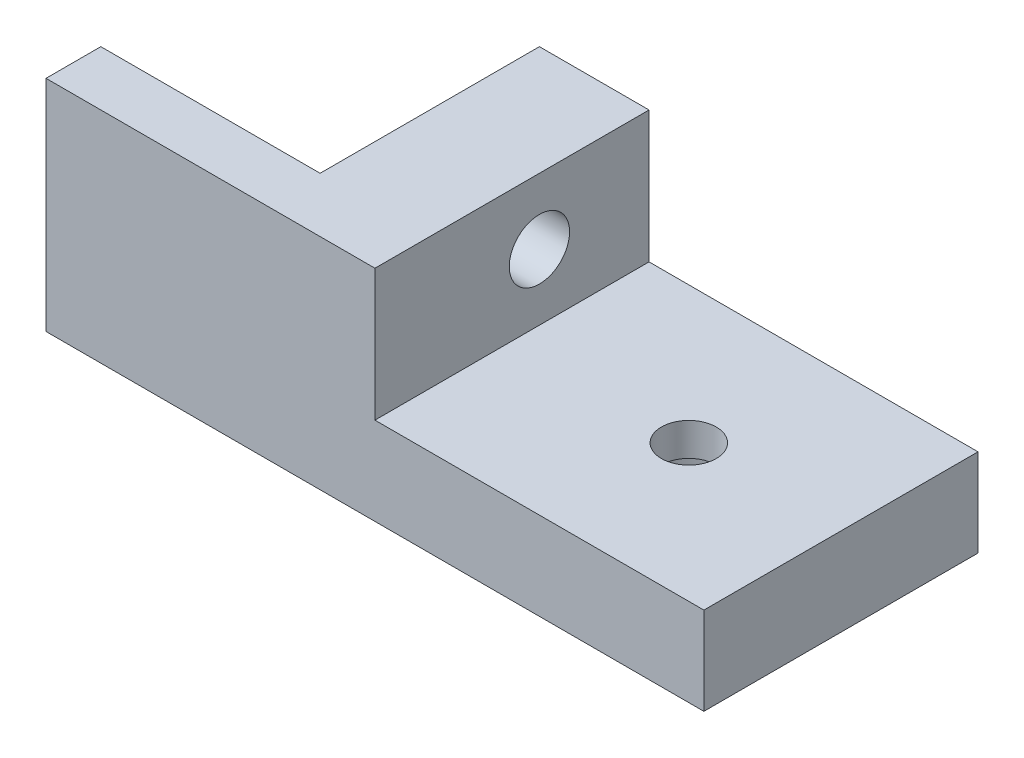
from build123d import *

# Parameters (mm, degrees)
BOSS_EXTRUDE1_DEPTH = 20
SKETCH2_W           = 30
SKETCH2_H           = 25
CUT_EXTRUDE1_DEPTH  = 12
SKETCH5_R           = 2.75
CUT_EXTRUDE4_DEPTH  = 44.874821937
SKETCH6_R           = 6.7
CUT_EXTRUDE5_DEPTH  = 5
SKETCH7_R           = 2.5
CUT_EXTRUDE6_DEPTH  = 67.708320321


with BuildPart() as part:
    # Sketch1 → Boss-Extrude1 (new body)
    with BuildSketch(Plane(origin=(0, 0, 0), x_dir=(1, 0, 0), z_dir=(0, 1, 0))):
        Polygon((0, 0), (60, 0), (60, 25), (20, 25), (20, 5), (0, 5), align=None)
    extrude(amount=BOSS_EXTRUDE1_DEPTH)

    # Sketch2 → Cut-Extrude1 (cut)
    with BuildSketch(Plane(origin=(0, 20, 0), x_dir=(1, 0, 0), z_dir=(0, 1, 0))):
        with Locations((45, 12.5)):
            Rectangle(SKETCH2_W, SKETCH2_H)
    extrude(amount=-CUT_EXTRUDE1_DEPTH, mode=Mode.SUBTRACT)

    # Sketch5 → Cut-Extrude4 (cut, through all)
    with BuildSketch(Plane(origin=(30, 0, 0), x_dir=(0, 0, -1), z_dir=(1, 0, 0))):
        with Locations((15, 14)):
            Circle(SKETCH5_R)
    extrude(amount=-CUT_EXTRUDE4_DEPTH, mode=Mode.SUBTRACT)

    # Sketch6 → Cut-Extrude5 (cut)
    with BuildSketch(Plane.XZ):
        with Locations((46.1, -12.525762493)):
            Circle(SKETCH6_R)
    extrude(amount=-CUT_EXTRUDE5_DEPTH, mode=Mode.SUBTRACT)

    # Sketch7 → Cut-Extrude6 (cut, through all)
    with BuildSketch(Plane.XZ.offset(-5)):
        with Locations((46.1, -12.525762493)):
            Circle(SKETCH7_R)
    extrude(amount=-CUT_EXTRUDE6_DEPTH, mode=Mode.SUBTRACT)


solid = part.part
